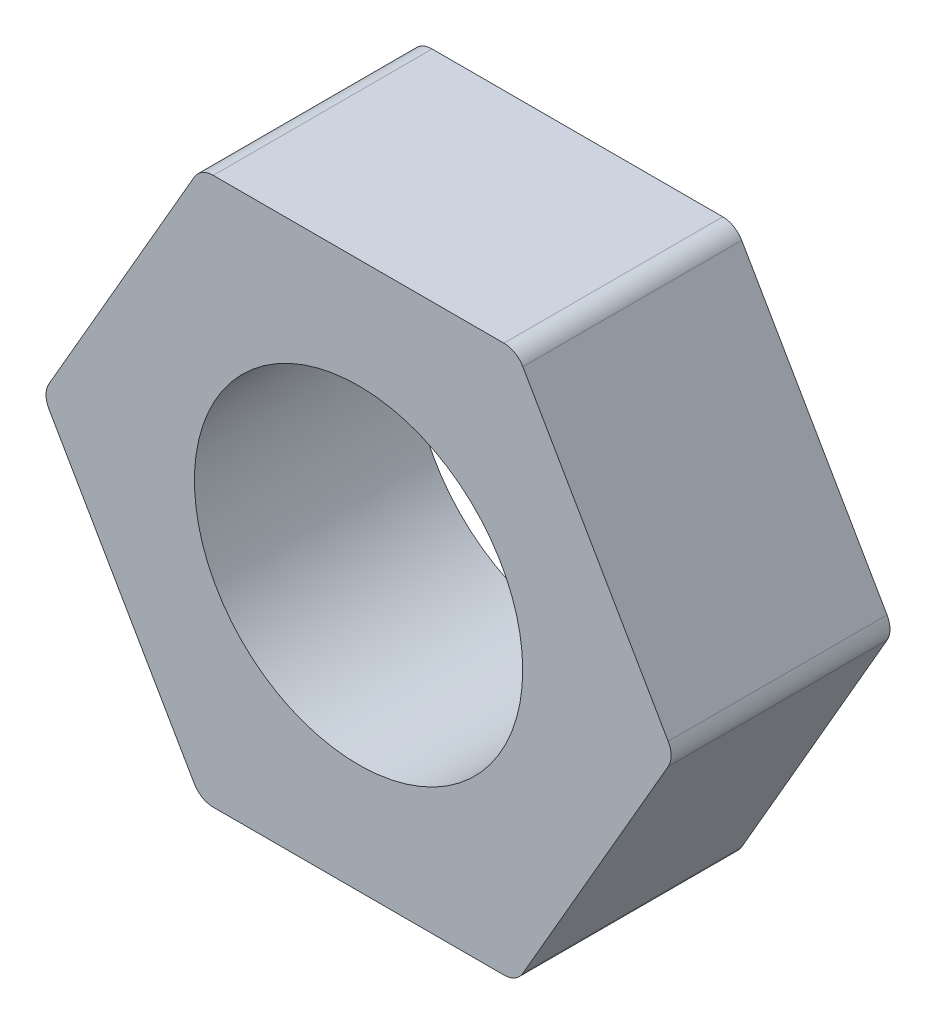
from build123d import *

# Parameters (mm, degrees)
SKETCH2_R           = 30
BOSS_EXTRUDE1_DEPTH = 40


with BuildPart() as part:
    # Sketch2 → Boss-Extrude1 (new body)
    with BuildSketch(Plane.XY):
        with BuildLine():
            ThreePointArc((488.580326381, -2), (489.116224765, 0), (488.580326381, 2))
            Line((488.580326381, 2), (462.022213998, 48))
            ThreePointArc((462.022213998, 48), (460.558112383, 49.464101615), (458.558112383, 50))
            Line((458.558112383, 50), (405.441887617, 50))
            ThreePointArc((405.441887617, 50), (403.441887617, 49.464101615), (401.977786002, 48))
            Line((401.977786002, 48), (375.419673619, 2))
            ThreePointArc((375.419673619, 2), (374.883775235, 0), (375.419673619, -2))
            Line((375.419673619, -2), (401.977786002, -48))
            ThreePointArc((401.977786002, -48), (403.441887617, -49.464101615), (405.441887617, -50))
            Line((405.441887617, -50), (458.558112383, -50))
            ThreePointArc((458.558112383, -50), (460.558112383, -49.464101615), (462.022213998, -48))
            Line((462.022213998, -48), (488.580326381, -2))
        make_face()
        with Locations((432, 0)):
            Circle(SKETCH2_R, mode=Mode.SUBTRACT)
    extrude(amount=BOSS_EXTRUDE1_DEPTH)


solid = part.part
